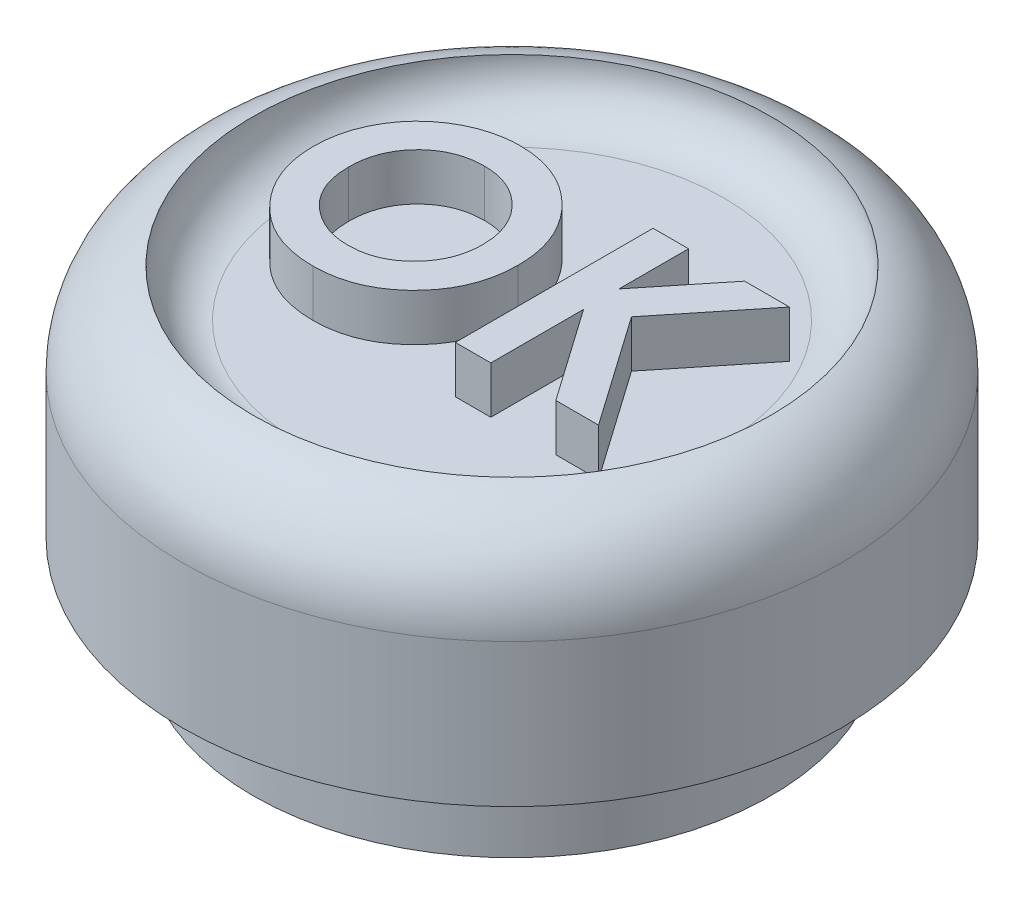
from build123d import *

# Parameters (mm, degrees)
SKETCH_1_R          = 5.5
EXTRUDE_1_DEPTH     = 7
CUT_EXTRUDE_START   = -1
SKETCH_2_R          = 5.5
CUT_EXTRUDE_1_DEPTH = 1
EXTRUDE_2_DEPTH     = 1
SKETCH_5_W          = 4
SKETCH_5_H          = 4
CUT_EXTRUDE_2_DEPTH = 3
FILLET_3_R          = 1


with BuildPart() as part:
    # Эскиз1 → Бобышка-Вытянуть1 (new body)
    with BuildSketch(Plane(origin=(0, 0, 0), x_dir=(1, 0, 0), z_dir=(0, 1, 0))):
        with Locations(Location((0, 0, 0), (0, 0, 270))):
            Circle(SKETCH_1_R)
    extrude(amount=EXTRUDE_1_DEPTH)

    # Эскиз6 → Повернуть3 (revolve)
    with BuildSketch(Plane.XY, mode=Mode.PRIVATE) as revolve_3_sk:
        with BuildLine():
            Line((-4.665230635, 2), (-7, 2))
            Line((-7, 2), (-7, 3))
            Line((-7, 3), (-7, 5.035898385))
            ThreePointArc((-7, 5.035898385), (-6.582112259, 6.271585962), (-5.5, 7))
            Line((-5.5, 7), (-4.665230635, 7))
            Line((-4.665230635, 7), (-4.665230635, 3))
            Line((-4.665230635, 3), (-4.665230635, 2))
        make_face()
    revolve(revolve_3_sk.sketch.rotate(Axis((0, -1000, 0), (0, 1, 0)), 180), axis=Axis((0, -1000, 0), (0, 1, 0)))

    # Эскиз2 → Вырез-Вытянуть1 (cut)
    with BuildSketch(Plane(origin=(0, 7, 0), x_dir=(1, 0, 0), z_dir=(0, 1, 0)).offset(CUT_EXTRUDE_START)):
        with Locations(Location((0, 0, 0), (0, 0, 180))):
            Circle(SKETCH_2_R)
    extrude(amount=CUT_EXTRUDE_1_DEPTH, mode=Mode.SUBTRACT)

    # Эскиз3 → Бобышка-Вытянуть2 (add)
    # profile 1 of 2: a face of its own
    with BuildSketch(Plane(origin=(0, 6, 0), x_dir=(1, 0, 0), z_dir=(0, 1, 0))):
        with BuildLine():
            add(Edge.make_bspline(
                [(-2.119769226, 2.297656666), (-2.046747078, 2.295765991), (-1.90258482, 2.292033372), (-1.690574161, 2.26091908), (-1.486262691, 2.2102228), (-1.289742798, 2.139751305), (-1.101506546, 2.047595868), (-0.920889962, 1.936369156), (-0.748540006, 1.803971831), (-0.586222783, 1.653492505), (-0.436212395, 1.489852809), (-0.306228306, 1.313665584), (-0.195382643, 1.129496016), (-0.103513461, 0.936850619), (-0.03353798, 0.734395232), (0.01556671, 0.523162109), (0.04711404, 0.303211345), (0.050742469, 0.153454853), (0.052586544, 0.077344166)],
                knots=[0, 0, 0, 0, 1.014329547, 2.002516266, 2.970391464, 3.935626869, 4.897733899, 5.877609409, 6.878433252, 7.912639331, 8.949961323, 9.958554974, 10.949718813, 11.932905612, 12.9188844, 13.919928257, 14.942845884, 16, 16, 16, 16], degree=3))
            add(Edge.make_bspline(
                [(0.052586544, 0.077344166), (0.050622684, 0.002091069), (0.046752835, -0.146197571), (0.01685461, -0.364121403), (-0.033077009, -0.573091779), (-0.101865651, -0.773581708), (-0.192068673, -0.964620087), (-0.300752725, -1.147426668), (-0.430785771, -1.320304963), (-0.577424997, -1.483162198), (-0.738862058, -1.630990084), (-0.909849534, -1.761263154), (-1.08959791, -1.871651637), (-1.277844091, -1.96210497), (-1.474991763, -2.032302471), (-1.680553946, -2.081831908), (-1.894517921, -2.111931947), (-2.040023801, -2.115776519), (-2.113879803, -2.11772795)],
                knots=[0, 0, 0, 0, 1.051557043, 2.072126891, 3.067553643, 4.050577992, 5.02905126, 6.015227836, 7.017913613, 8.04756643, 9.074058332, 10.072836633, 11.047628519, 12.017157415, 12.98668631, 13.966869689, 14.968021931, 16, 16, 16, 16], degree=3))
            add(Edge.make_bspline(
                [(-2.113879803, -2.11772795), (-2.191124325, -2.11597742), (-2.342899253, -2.112537868), (-2.565022539, -2.079829301), (-2.777835841, -2.030558773), (-2.979551403, -1.957025153), (-3.172223527, -1.865101945), (-3.354436593, -1.751893002), (-3.526129367, -1.617585413), (-3.68631699, -1.465618843), (-3.831447364, -1.299334085), (-3.959553386, -1.123668983), (-4.067613658, -0.939965466), (-4.155632133, -0.748137555), (-4.225022363, -0.549377415), (-4.273969286, -0.342474539), (-4.302883401, -0.127925156), (-4.30691097, 0.017801074), (-4.308951918, 0.09164705)],
                knots=[0, 0, 0, 0, 1.067978421, 2.098431617, 3.099715153, 4.085208694, 5.062210972, 6.048429807, 7.046490867, 8.072918869, 9.098532598, 10.095778865, 11.076610158, 12.041847152, 13.011192615, 13.984257998, 14.978533688, 16, 16, 16, 16], degree=3))
            add(Edge.make_bspline(
                [(-4.308951918, 0.09164705), (-4.308311351, 0.141326757), (-4.307038327, 0.240057111), (-4.291703421, 0.386370456), (-4.269625564, 0.529827961), (-4.236973461, 0.669857659), (-4.197309501, 0.807447394), (-4.145919239, 0.941316447), (-4.087423212, 1.072894908), (-4.019076113, 1.200628669), (-3.943080748, 1.323342475), (-3.860163038, 1.440457461), (-3.770114489, 1.550557538), (-3.673225176, 1.654366237), (-3.569161205, 1.751201216), (-3.459291432, 1.842433309), (-3.341485021, 1.925639068), (-3.218320386, 2.002850542), (-3.0904919, 2.072671539), (-2.958519942, 2.132101084), (-2.825123394, 2.183999893), (-2.688520259, 2.224960728), (-2.550174481, 2.2583229), (-2.408608118, 2.280385876), (-2.265100139, 2.295720358), (-2.16832783, 2.297009698), (-2.119769226, 2.297656666)],
                knots=[0, 0, 0, 0, 1.034744296, 2.056386356, 3.06226378, 4.057406941, 5.050368692, 6.043467995, 7.042652155, 8.049140477, 9.059438543, 10.048523776, 11.036952808, 12.020949711, 13.004946614, 13.997082645, 14.994316842, 16.007702937, 17.024872941, 18.026463647, 19.021641123, 20.005082605, 20.995858141, 21.984425357, 22.988620895, 24, 24, 24, 24], degree=3))
        make_face()
        with BuildLine():
            add(Edge.make_bspline(
                [(-2.131548072, 1.543810512), (-2.180691967, 1.542491871), (-2.277682351, 1.539889401), (-2.419949581, 1.520062101), (-2.556531146, 1.48839565), (-2.686669921, 1.442527182), (-2.810929937, 1.384148264), (-2.92953147, 1.313462878), (-3.040832134, 1.228041294), (-3.146316015, 1.132469416), (-3.241603344, 1.02598038), (-3.325792705, 0.911859268), (-3.39624564, 0.790296659), (-3.455250415, 0.662421843), (-3.499667933, 0.5267969), (-3.531305199, 0.384484194), (-3.55129877, 0.235238516), (-3.553818985, 0.133497931), (-3.555105764, 0.081550896)],
                knots=[0, 0, 0, 0, 1.033739768, 2.040188636, 3.016340934, 3.979330865, 4.937572243, 5.900995986, 6.878200029, 7.884839167, 8.891893314, 9.879764717, 10.863503415, 11.843163062, 12.837761627, 13.859916423, 14.907309254, 16, 16, 16, 16], degree=3))
            add(Edge.make_bspline(
                [(-3.555105764, 0.081550896), (-3.553399691, 0.023981897), (-3.550056071, -0.088843804), (-3.526529955, -0.253430896), (-3.48627911, -0.408867069), (-3.428157674, -0.554392109), (-3.356071845, -0.691621961), (-3.266552686, -0.818874678), (-3.161049983, -0.936912192), (-3.079771556, -1.005827408), (-3.038519226, -1.040804873)],
                knots=[0, 0, 0, 0, 1.078454662, 2.113592447, 3.107694534, 4.079536787, 5.043276885, 6.005368276, 6.987637804, 8, 8, 8, 8], degree=3))
            add(Edge.make_bspline(
                [(-3.038519226, -1.040804873), (-3.004725691, -1.06664488), (-2.937899997, -1.117742715), (-2.83123164, -1.183235073), (-2.721384236, -1.239368557), (-2.607528848, -1.284723748), (-2.489905935, -1.320399379), (-2.368531624, -1.345382437), (-2.243577894, -1.361061466), (-2.159078326, -1.362935407), (-2.116403841, -1.363881796)],
                knots=[0, 0, 0, 0, 1.023928204, 2.024787132, 3.009472467, 3.9914905, 4.972207045, 5.96565515, 6.972602802, 8, 8, 8, 8], degree=3))
            add(Edge.make_bspline(
                [(-2.116403841, -1.363881796), (-2.068104976, -1.362551974), (-1.97307544, -1.359935508), (-1.833456591, -1.340352294), (-1.699697494, -1.307210424), (-1.570967759, -1.26174433), (-1.447638587, -1.202632414), (-1.330312721, -1.12975459), (-1.218784456, -1.044005703), (-1.11343496, -0.947178757), (-1.01714054, -0.840270228), (-0.933126865, -0.725540405), (-0.860433879, -0.60551713), (-0.802656109, -0.478501656), (-0.756483756, -0.345692949), (-0.725227261, -0.206502827), (-0.705064789, -0.061505087), (-0.702543864, 0.037171), (-0.70125961, 0.087440319)],
                knots=[0, 0, 0, 0, 1.026359118, 2.019393844, 2.989460624, 3.950973911, 4.916101784, 5.890408035, 6.881132271, 7.902007068, 8.92769091, 9.933912415, 10.920395702, 11.90457117, 12.894218921, 13.903490204, 14.931958862, 16, 16, 16, 16], degree=3))
            add(Edge.make_bspline(
                [(-0.70125961, 0.087440319), (-0.7025883, 0.137420576), (-0.705203622, 0.235799089), (-0.724821305, 0.380424042), (-0.757752997, 0.518999679), (-0.803355621, 0.651752311), (-0.861587756, 0.778812083), (-0.933597699, 0.899732178), (-1.019132775, 1.014395696), (-1.1162244, 1.12202125), (-1.221902667, 1.22092224), (-1.335358845, 1.30675032), (-1.453418304, 1.381332193), (-1.578789904, 1.439756621), (-1.708908647, 1.486303239), (-1.844568523, 1.520580836), (-1.986283354, 1.539750113), (-2.082694884, 1.542444981), (-2.131548072, 1.543810512)],
                knots=[0, 0, 0, 0, 1.055025985, 2.07665775, 3.074803781, 4.057872707, 5.035505728, 6.020516407, 7.023567878, 8.050795229, 9.077271434, 10.074415901, 11.050397877, 12.019801805, 12.988065821, 13.964604439, 14.968634123, 16, 16, 16, 16], degree=3))
        make_face(mode=Mode.SUBTRACT)
    # profile 2 of 2: a face of its own
    with BuildSketch(Plane(origin=(0, 6, 0), x_dir=(1, 0, 0), z_dir=(0, 1, 0))):
        Polygon((0.806432697, 2.189964358), (1.560278851, 2.189964358), (1.560278851, 0.711719166), (2.751625005, 2.189964358), (3.703187505, 2.189964358), (2.206432697, 0.33227205), (3.84874039, -2.010035642), (2.94092789, -2.010035642), (1.560278851, -0.040444296), (1.560278851, -2.010035642), (0.806432697, -2.010035642), align=None)
    extrude(amount=EXTRUDE_2_DEPTH)

    # Эскиз5 → Вырез-Вытянуть2 (cut)
    with BuildSketch(Plane.XZ):
        Rectangle(SKETCH_5_W, SKETCH_5_H)
    extrude(amount=-CUT_EXTRUDE_2_DEPTH, mode=Mode.SUBTRACT)

    # Скругление3
    fillet_3_edges = [part.edges().sort_by_distance(p)[0] for p in [
        (5.5, 6, 0),
    ]]
    fillet(fillet_3_edges, radius=FILLET_3_R - 0.0001)  # a hair under: the kernel refuses the full size


solid = part.part
